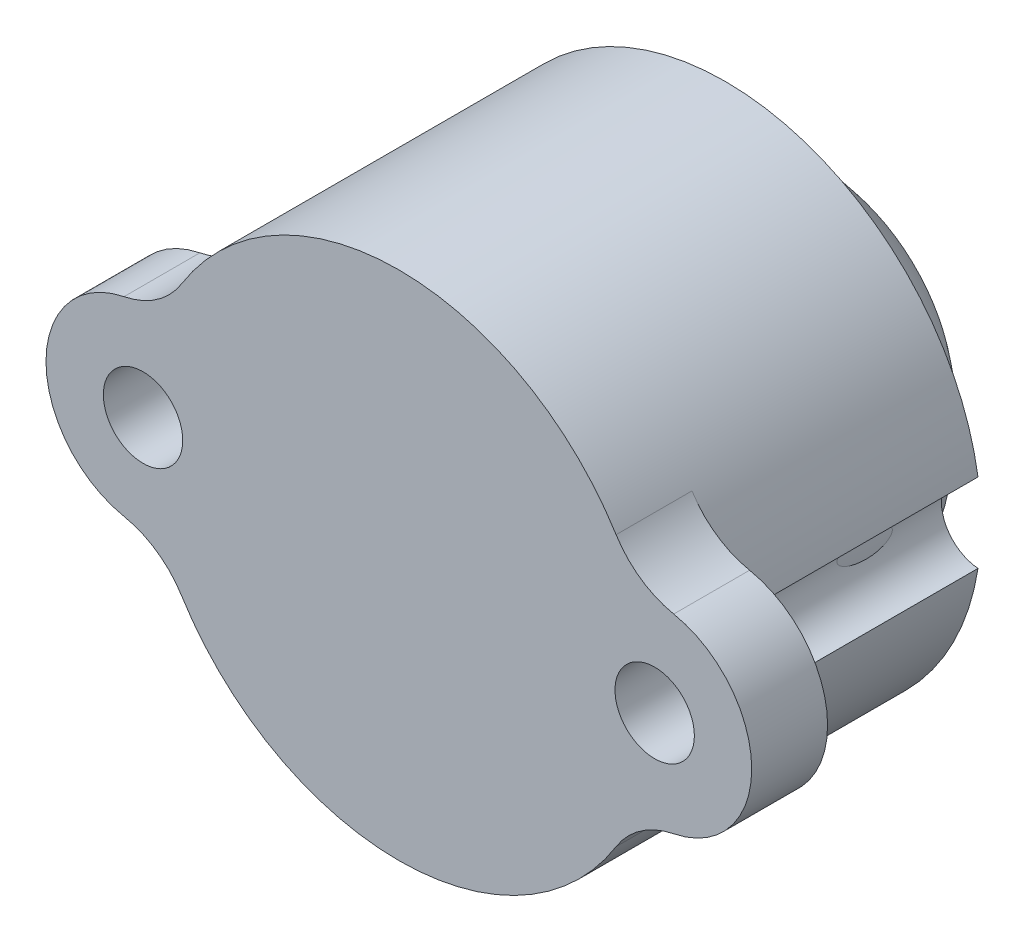
from build123d import *

# Parameters (mm, degrees)
ESQUISSE1_R             = 7.366
BOSS_EXTRU_1_DEPTH      = 9.398
BOSS_EXTRU_2_START      = -2.1844
BOSS_EXTRU_2_DEPTH      = 2.1844
CONG_1_R                = 2.54
ESQUISSE3_R             = 1.143
ENL_V_MAT_EXTRU_2_DEPTH = 16.678200152


with BuildPart() as part:
    # Esquisse1 → Boss.-Extru.1 (new body)
    with BuildSketch(Plane.XY):
        Circle(ESQUISSE1_R)
    extrude(amount=BOSS_EXTRU_1_DEPTH)

    # Esquisse2 → Boss.-Extru.2 (add)
    with BuildSketch(Plane.XY.offset(9.398).offset(BOSS_EXTRU_2_START)):
        with BuildLine():
            Line((7.366, 2.794), (6.815535195, 2.794))
            ThreePointArc((6.815535195, 2.794), (7.22707369, 1.423854584), (7.366, 0))
            Line((7.366, 0), (10.16, 0))
            ThreePointArc((10.16, 0), (9.341656347, 1.975656347), (7.366, 2.794))
        make_face()
        with BuildLine():
            Line((10.16, 0), (7.366, 0))
            ThreePointArc((7.366, 0), (7.22707369, -1.423854584), (6.815535195, -2.794))
            Line((6.815535195, -2.794), (7.366, -2.794))
            ThreePointArc((7.366, -2.794), (9.341656347, -1.975656347), (10.16, 0))
        make_face()
        with BuildLine():
            Line((-7.366, 0), (-10.16, 0))
            ThreePointArc((-10.16, 0), (-9.341656347, -1.975656347), (-7.366, -2.794))
            Line((-7.366, -2.794), (-6.815535195, -2.794))
            ThreePointArc((-6.815535195, -2.794), (-7.22707369, -1.423854584), (-7.366, 0))
        make_face()
        with BuildLine():
            Line((-6.815535195, 2.794), (-7.366, 2.794))
            ThreePointArc((-7.366, 2.794), (-9.341656347, 1.975656347), (-10.16, 0))
            Line((-10.16, 0), (-7.366, 0))
            ThreePointArc((-7.366, 0), (-7.22707369, 1.423854584), (-6.815535195, 2.794))
        make_face()
    extrude(amount=BOSS_EXTRU_2_DEPTH)

    # Congé1
    # the kernel refuses this fillet: 2.54 mm, written as the material it adds along each edge
    with BuildSketch(Plane(origin=(6.815535195, 2.794, 7.2136), x_dir=(-0.45524151464262924, 0.8903679932173465, 0), z_dir=(0, 0, 1)), Plane(origin=(-6.815535195, -2.794, 7.2136), x_dir=(0.4552415146426176, -0.8903679932173524, 0), z_dir=(0, 0, 1))) as cong_1_piece_1:
        with BuildLine():
            CenterArc((1.442130851, -2.531130754), CONG_1_R, 94.789504406, 46.813825589)
            Line((-0.548542223, -0.953531086), (-0.74760953, -0.795771119))
            ThreePointArc((-0.74760953, -0.795771119), (-0.476747902, -0.374484899), (-0.22615347, 0.115631345))
            Line((-0.22615347, 0.115631345), (0.021207807, 0.253113075))
            ThreePointArc((0.021207807, 0.253113075), (0.615026392, 0.228279187), (1.208844978, 0.253113075))
            Line((1.208844978, 0.253113075), (1.230052785, 0))
        make_face()
    extrude(amount=2.1844)
    with BuildSketch(Plane(origin=(6.815535195, -2.794, 7.2136), x_dir=(-0.4552415146426287, -0.8903679932173468, 0), z_dir=(0, 0, 1)), Plane(origin=(-6.815535195, 2.794, 7.2136), x_dir=(0.45524151464261825, 0.890367993217352, 0), z_dir=(0, 0, 1))) as cong_1_piece_2:
        with BuildLine():
            CenterArc((1.442130851, 2.531130754), CONG_1_R, 218.396670004, 46.813825589)
            Line((-0.548542223, 0.953531086), (-0.74760953, 0.795771119))
            ThreePointArc((-0.74760953, 0.795771119), (-0.476747902, 0.374484899), (-0.22615347, -0.115631345))
            Line((-0.22615347, -0.115631345), (0.021207807, -0.253113075))
            ThreePointArc((0.021207807, -0.253113075), (0.615026392, -0.228279187), (1.208844978, -0.253113075))
            Line((1.208844978, -0.253113075), (1.230052785, 0))
        make_face()
    extrude(amount=2.1844)

    # Esquisse3 → Enlèv. mat.-Extru.2 (cut, through all)
    with BuildSketch(Plane.XY.offset(9.398)):
        with Locations((-7.366, 0)):
            Circle(ESQUISSE3_R)
        with Locations((7.366, 0)):
            Circle(ESQUISSE3_R)
    extrude(amount=-ENL_V_MAT_EXTRU_2_DEPTH, mode=Mode.SUBTRACT)

    # Esquisse4 → Révolution4 (revolve)
    with BuildSketch(Plane(origin=(0, 0, 0), x_dir=(0, 0, -1), z_dir=(1, 0, 0))):
        with BuildLine():
            Line((-8.4836, 0), (4.064, 0))
            ThreePointArc((4.064, 0), (-2.2098, 6.2738), (-8.4836, 0))
        make_face()
    revolve(axis=Axis((0, 0, 7.037287666), (0, 0, -1)))


solid = part.part
